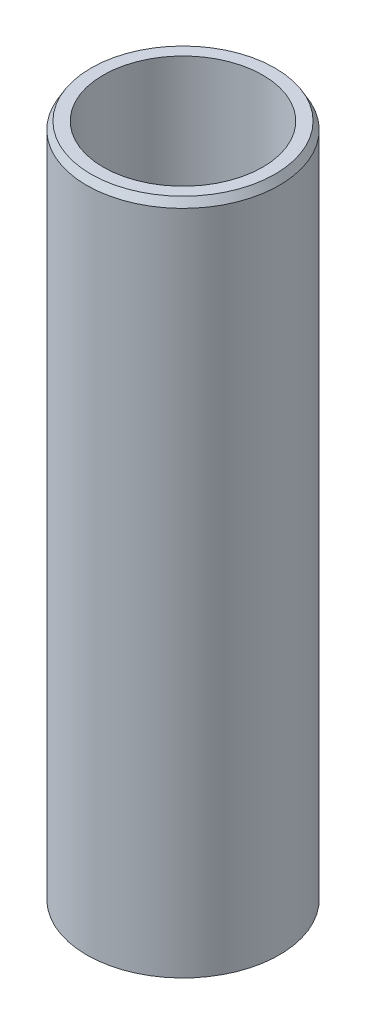
from build123d import *
from OCP.BRepFilletAPI import BRepFilletAPI_MakeChamfer

# Parameters (mm, degrees)
SKETCH1_R           = 57.5
BOSS_EXTRUDE1_DEPTH = 404.954098009
SKETCH2_R           = 47.62750027
CUT_EXTRUDE1_DEPTH  = 414.037917744
CHAMFER1_SIZE       = 4.475251038
CHAMFER1_SIZE2      = 2.583787392


with BuildPart() as part:
    # Sketch1 → Boss-Extrude1 (new body)
    with BuildSketch(Plane(origin=(0, 0, 0), x_dir=(1, 0, 0), z_dir=(0, 1, 0))):
        Circle(SKETCH1_R)
    extrude(amount=BOSS_EXTRUDE1_DEPTH)

    # Sketch2 → Cut-Extrude1 (cut, through all)
    with BuildSketch(Plane(origin=(0, 0, 0), x_dir=(1, 0, 0), z_dir=(0, 1, 0))):
        Circle(SKETCH2_R)
    extrude(amount=CUT_EXTRUDE1_DEPTH, mode=Mode.SUBTRACT)

    # Chamfer1: one chamfer whose edges measure the first distance from different faces: ONE call of the kernel's chamfer builder (chamfer() names one face for all edges)
    chamfer1_edges_1 = [part.edges().sort_by_distance(p)[0] for p in [
        (-57.5, 404.954098009, 0),
    ]]
    chamfer1_side_1 = [part.faces().sort_by_distance(p)[0] for p in [
        (-57.5, 202.477049005, 0),
    ]]
    chamfer1_edges_2 = [part.edges().sort_by_distance(p)[0] for p in [
        (-57.5, 0, 0),
    ]]
    chamfer1_side_2 = [part.faces().sort_by_distance(p)[0] for p in [
        (-55.873654403, 0, 0),
    ]]
    chamfer1 = BRepFilletAPI_MakeChamfer(part.part.solid().wrapped)
    for e in chamfer1_edges_1:
        chamfer1.Add(CHAMFER1_SIZE, CHAMFER1_SIZE2, e.wrapped, chamfer1_side_1[0].wrapped)  # the first distance lies on this face
    for e in chamfer1_edges_2:
        chamfer1.Add(CHAMFER1_SIZE, CHAMFER1_SIZE2, e.wrapped, chamfer1_side_2[0].wrapped)  # the first distance lies on this face
    add(Compound.cast(chamfer1.Shape()), mode=Mode.REPLACE)


solid = part.part
